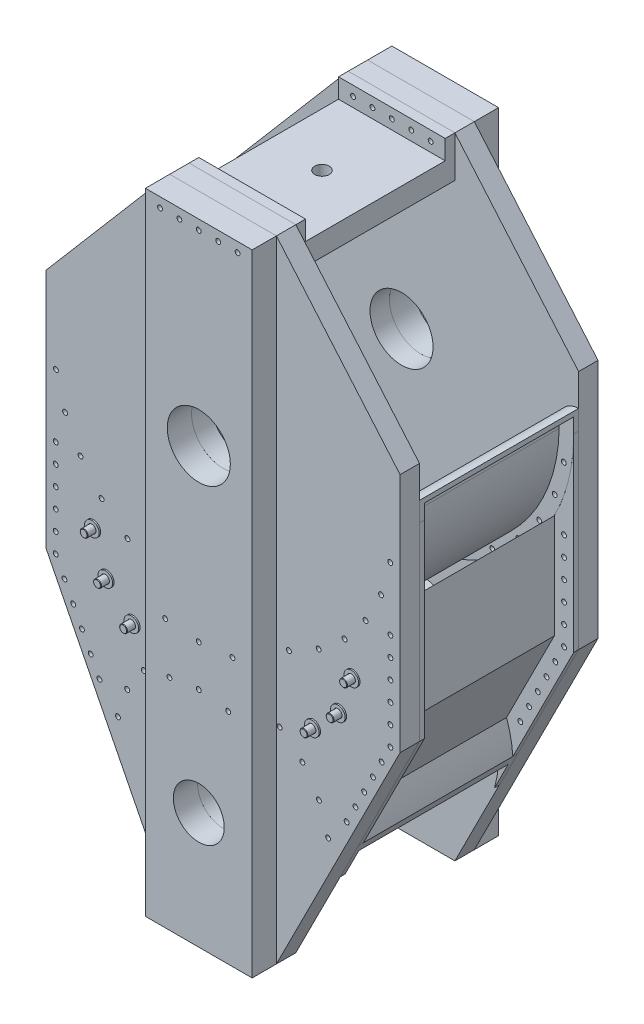
from build123d import *
from build123d.topology import SkipClean

# Parameters (mm, degrees)
PIASTRONEEXTR_DEPTH              = 40
LAMONE_DEPTH                     = 50
CARTEREXT1_START                 = 40
CARTEREXT1_DEPTH                 = 10
CARTEREXT2_START                 = 50
CARTEREXT2_DEPTH                 = 154
IRRIGIDCIRC1_START               = 40
IRRIGIDCIRC1_DEPTH               = 10
IRRIGIDCIRC2_START               = 50
IRRIGIDCIRC2_DEPTH               = 154
IRRIGIDESTERNO1_START            = 40
IRRIGIDESTERNO1_DEPTH            = 10
IRRIGIDESTERNO2_START            = 50
IRRIGIDESTERNO2_DEPTH            = 154
RINFORZOSUP1_START               = 40
SKETCH12_W                       = 110
SKETCH12_H                       = 85
RINFORZOSUP1_DEPTH               = 20
BOSS_EXTRUDE1_START              = 60
SKETCH12_4_W                     = 110
SKETCH12_4_H                     = 45
BOSS_EXTRUDE1_DEPTH              = 144
FOROCIRC3_START                  = -879.840067
SKETCH6_R                        = 5
FOROCIRC3_DEPTH                  = 1839.680133
LPATTERN11_COUNT                 = 6
LPATTERN11_PITCH                 = 40
LPATTERN21_COUNT                 = 6
LPATTERN21_PITCH                 = 40
FORIIRR_R                        = 9
FORICENTRALI_DEPTH               = 120
BUSSOLA_R                        = 18.5
BUSSOLA_R_2                      = 10.5
ROSETTA_DEPTH                    = 3
ROSETTA_2_DEPTH                  = 3
ROSETTA_3_DEPTH                  = 3
SKETCH16_R                       = 15
SKETCH16_R_2                     = 10.5
BUSSOLABODY_DEPTH                = 14
SKETCH17_R                       = 18.5
SKETCH17_R_2                     = 15.5
TUBO_DEPTH                       = 161
TUBO_2_DEPTH                     = 161
TUBO_3_DEPTH                     = 161
TIRANTE_DEPTH                    = 164
TIRANTE_DEPTH_BACK               = 60
SKETCH18_R                       = 8
TIRANTE_2_DEPTH                  = 164
TIRANTE_2_DEPTH_BACK             = 60
TIRANTE_3_DEPTH                  = 164
TIRANTE_3_DEPTH_BACK             = 60
CHAMFER1_SIZE                    = 1
CHAMFER2_SIZE                    = 1
CHAMFER3_SIZE                    = 1
SKETCH19_R                       = 15
SKETCH19_R_2                     = 8.5
ROSETTAM20_DEPTH                 = 3
ROSETTAM20_2_DEPTH               = 3
ROSETTAM20_3_DEPTH               = 3
SKETCH11_R                       = 5
FOROSUPERIORE_DEPTH              = 948.744578
LPATTERN23_COUNT                 = 3
LPATTERN23_PITCH                 = 40
LPATTERN23_COL_COUNT             = 3
LPATTERN23_COL_PITCH             = 40
FOROCIRC11_START                 = -948.744578
FORICIRC1_R                      = 5
FOROCIRC11_DEPTH                 = 1967.489157
CIRPATTERN24_COUNT               = 8
CIRPATTERN24_ANGLE               = 80
CIRPATTERN24_THE_OTHER_WAY_COUNT = 8
CIRPATTERN24_THE_OTHER_WAY_ANGLE = 80
FOROCIRC21_START                 = -948.744578
FOROCRIC2_R                      = 5
FOROCIRC21_DEPTH                 = 1977.489157
CIRPATTERN21_COUNT               = 6
CIRPATTERN21_ANGLE               = 80
CIRPATTERN21_THE_OTHER_WAY_COUNT = 6
CIRPATTERN21_THE_OTHER_WAY_ANGLE = 80
SKETCH20_R                       = 15
CUT_EXTRUDE1_DEPTH               = 1415.549517


with BuildPart() as part:
    # Piastrone → PiastroneExtr (new body)
    with BuildSketch(Plane.XY):
        with BuildLine():
            Line((-86.205427, 491.90505), (23.794573, 491.90505))
            Line((23.794573, 491.90505), (278.794573, 193.153386))
            Line((278.794573, 193.153386), (278.794573, -303.297279))
            Line((278.794573, -303.297279), (23.794573, -808.09495))
            Line((23.794573, -808.09495), (-86.205427, -808.09495))
            Line((-86.205427, -808.09495), (-86.205427, -620.59495))
            ThreePointArc((-86.205427, -620.59495), (-33.705427, -568.09495), (-86.205427, -515.59495))
            Line((-86.205427, -515.59495), (-86.205427, 21.90505))
            ThreePointArc((-86.205427, 21.90505), (-21.205427, 86.90505), (-86.205427, 151.90505))
            Line((-86.205427, 151.90505), (-86.205427, 491.90505))
        make_face()
    extrude(amount=PIASTRONEEXTR_DEPTH)


with BuildPart() as body_2:
    # Sketch14 → Lamone (new body)
    with BuildSketch(Plane(origin=(0, 0, 0), x_dir=(-1, 0, 0), z_dir=(0, 0, -1))):
        with BuildLine():
            Line((-23.794573, 491.90505), (86.205427, 491.90505))
            Line((86.205427, 491.90505), (86.205427, 151.90505))
            ThreePointArc((86.205427, 151.90505), (21.205427, 86.90505), (86.205427, 21.90505))
            Line((86.205427, 21.90505), (86.205427, -515.59495))
            ThreePointArc((86.205427, -515.59495), (33.705427, -568.09495), (86.205427, -620.59495))
            Line((86.205427, -620.59495), (86.205427, -808.09495))
            Line((86.205427, -808.09495), (-23.794573, -808.09495))
            Line((-23.794573, -808.09495), (-23.794573, 491.90505))
        make_face()
    extrude(amount=LAMONE_DEPTH)


with BuildPart() as body_3:
    # Carter → CarterExt1 (new body)
    with BuildSketch(Plane.XY.offset(CARTEREXT1_START)):
        with BuildLine():
            ThreePointArc((248.758008, 81.955617), (255.585083, 106.603062), (278.794573, 117.346667))
            Line((278.794573, 117.346667), (278.794573, 86.90505))
            ThreePointArc((278.794573, 86.90505), (171.888548, -171.188925), (-86.205427, -278.09495))
            Line((-86.205427, -278.09495), (-86.205427, -248.09495))
            ThreePointArc((-86.205427, -248.09495), (148.918944, -151.719195), (248.758008, 81.955617))
        make_face()
        with BuildLine():
            ThreePointArc((-86.205427, -248.09495), (148.918944, -151.719195), (248.758008, 81.955617))
            ThreePointArc((248.758008, 81.955617), (255.585083, 106.603062), (278.794573, 117.346667))
            Line((278.794573, 117.346667), (278.794573, 127.247816))
            ThreePointArc((278.794573, 127.247816), (248.567893, 113.623706), (238.756849, 81.953343))
            ThreePointArc((238.756849, 81.953343), (141.846864, -144.648729), (-86.205427, -238.09495))
            Line((-86.205427, -238.09495), (-86.205427, -248.09495))
        make_face()
    extrude(amount=CARTEREXT1_DEPTH)

    # Carter<4> → CarterExt2 (add)
    with BuildSketch(Plane.XY.offset(CARTEREXT2_START)):
        with BuildLine():
            ThreePointArc((-86.205427, -248.09495), (148.918944, -151.719195), (248.758008, 81.955617))
            ThreePointArc((248.758008, 81.955617), (255.585083, 106.603062), (278.794573, 117.346667))
            Line((278.794573, 117.346667), (278.794573, 127.247816))
            ThreePointArc((278.794573, 127.247816), (248.567893, 113.623706), (238.756849, 81.953343))
            ThreePointArc((238.756849, 81.953343), (141.846864, -144.648729), (-86.205427, -238.09495))
            Line((-86.205427, -238.09495), (-86.205427, -248.09495))
        make_face()
    extrude(amount=CARTEREXT2_DEPTH)


with BuildPart() as body_4:
    # IrrigidCirc → IrrigidCirc1 (new body)
    with BuildSketch(Plane.XY.offset(IRRIGIDCIRC1_START)):
        with BuildLine():
            ThreePointArc((-86.205427, -338.09495), (77.301662, -406.337627), (143.781261, -570.569457))
            Line((143.781261, -570.569457), (115.48454, -626.58561))
            ThreePointArc((115.48454, -626.58561), (81.697876, -441.966124), (-86.205427, -358.09495))
            Line((-86.205427, -358.09495), (-86.205427, -338.09495))
        make_face()
        with BuildLine():
            ThreePointArc((-86.205427, -328.09495), (77.651834, -392.735895), (153.243359, -551.8383))
            Line((153.243359, -551.8383), (143.781261, -570.569457))
            ThreePointArc((143.781261, -570.569457), (77.301662, -406.337627), (-86.205427, -338.09495))
            Line((-86.205427, -338.09495), (-86.205427, -328.09495))
        make_face()
    extrude(amount=IRRIGIDCIRC1_DEPTH)

    # IrrigidCirc<7> → IrrigidCirc2 (add)
    with BuildSketch(Plane.XY.offset(IRRIGIDCIRC2_START)):
        with BuildLine():
            ThreePointArc((-86.205427, -328.09495), (77.651834, -392.735895), (153.243359, -551.8383))
            Line((153.243359, -551.8383), (143.781261, -570.569457))
            ThreePointArc((143.781261, -570.569457), (77.301662, -406.337627), (-86.205427, -338.09495))
            Line((-86.205427, -338.09495), (-86.205427, -328.09495))
        make_face()
    extrude(amount=IRRIGIDCIRC2_DEPTH)


with BuildPart() as body_5:
    # Sketch9 → IrrigidEsterno1 (new body)
    with BuildSketch(Plane.XY.offset(IRRIGIDESTERNO1_START)):
        with BuildLine():
            Line((238.794573, -293.767656), (278.794573, -303.297279))
            Line((278.794573, -303.297279), (278.794573, 86.90505))
            ThreePointArc((278.794573, 86.90505), (268.6537, 1.465012), (238.794573, -79.227428))
            Line((238.794573, -79.227428), (238.794573, -293.767656))
        make_face()
        with BuildLine():
            Line((153.243359, -551.8383), (278.794573, -303.297279))
            Line((278.794573, -303.297279), (238.794573, -293.767656))
            Line((238.794573, -293.767656), (140.29903, -488.749307))
            ThreePointArc((140.29903, -488.749307), (148.897022, -519.857635), (153.243359, -551.8383))
        make_face()
        with BuildLine():
            Line((140.29903, -488.749307), (238.794573, -293.767656))
            Line((238.794573, -293.767656), (228.794573, -291.385251))
            Line((228.794573, -291.385251), (135.473141, -476.124236))
            ThreePointArc((135.473141, -476.124236), (137.974978, -482.402793), (140.29903, -488.749307))
        make_face()
        with BuildLine():
            Line((228.794573, -291.385251), (238.794573, -293.767656))
            Line((238.794573, -293.767656), (238.794573, -79.227428))
            ThreePointArc((238.794573, -79.227428), (233.924769, -88.427941), (228.794573, -97.485839))
            Line((228.794573, -97.485839), (228.794573, -291.385251))
        make_face()
    extrude(amount=IRRIGIDESTERNO1_DEPTH)

    # Sketch9<3> → IrrigidEsterno2 (add)
    with BuildSketch(Plane.XY.offset(IRRIGIDESTERNO2_START)):
        with BuildLine():
            Line((228.794573, -291.385251), (238.794573, -293.767656))
            Line((238.794573, -293.767656), (238.794573, -79.227428))
            ThreePointArc((238.794573, -79.227428), (233.924769, -88.427941), (228.794573, -97.485839))
            Line((228.794573, -97.485839), (228.794573, -291.385251))
        make_face()
        with BuildLine():
            Line((140.29903, -488.749307), (238.794573, -293.767656))
            Line((238.794573, -293.767656), (228.794573, -291.385251))
            Line((228.794573, -291.385251), (135.473141, -476.124236))
            ThreePointArc((135.473141, -476.124236), (137.974978, -482.402793), (140.29903, -488.749307))
        make_face()
    extrude(amount=IRRIGIDESTERNO2_DEPTH)


with BuildPart() as body_6:
    # Sketch12 → RinforzoSup1 (new body)
    with BuildSketch(Plane.XY.offset(RINFORZOSUP1_START)):
        with Locations((-31.205427, 449.40505)):
            Rectangle(SKETCH12_W, SKETCH12_H)
    extrude(amount=RINFORZOSUP1_DEPTH)

    # Sketch12<4> → Boss-Extrude1 (add)
    with BuildSketch(Plane.XY.offset(BOSS_EXTRUDE1_START)):
        with Locations((-31.205427, 429.40505)):
            Rectangle(SKETCH12_4_W, SKETCH12_4_H)
    extrude(amount=BOSS_EXTRUDE1_DEPTH)


with BuildPart() as forocirc3_tool:
    # Sketch6 → ForoCirc3 (new body)
    with BuildSketch(Plane.XY.offset(FOROCIRC3_START)):
        with Locations(Location((258.794573, -303.297279, 0), (0, 0, 180))):
            Circle(SKETCH6_R)
    forocirc3 = extrude(amount=FOROCIRC3_DEPTH)


with BuildPart() as part_1:
    add(part.part)

    # ForoCirc3: cut by forocirc3_tool
    add(forocirc3_tool.part, mode=Mode.SUBTRACT)


with BuildPart() as body_5_1:
    add(body_5.part)

    # ForoCirc3: cut by forocirc3_tool
    add(forocirc3_tool.part, mode=Mode.SUBTRACT)


with BuildPart() as lpattern11_tool:
    # LPattern11: ForoCirc3 ×6
    with Locations(*[(0, i * LPATTERN11_PITCH, 0) for i in range(1, LPATTERN11_COUNT)]):
        add(forocirc3)


with BuildPart() as part_2:
    add(part_1.part)

    # LPattern11: cut by lpattern11_tool
    add(lpattern11_tool.part, mode=Mode.SUBTRACT)


with BuildPart() as body_5_2:
    add(body_5_1.part)

    # LPattern11: cut by lpattern11_tool
    add(lpattern11_tool.part, mode=Mode.SUBTRACT)


with BuildPart() as lpattern21_tool:
    # LPattern21: ForoCirc3 ×6
    with Locations(*[Vector(-0.45088930046580106, -0.8925798780644008, 0) * (i * LPATTERN21_PITCH) for i in range(1, LPATTERN21_COUNT)]):
        add(forocirc3)


with BuildPart() as part_3:
    add(part_2.part)

    # LPattern21: cut by lpattern21_tool
    add(lpattern21_tool.part, mode=Mode.SUBTRACT)

    # ForiIrr → ForiCentrali (cut)
    with BuildSketch(Plane.XY):
        with Locations(Location((99.794573, -348.09495, 0), (0, 0, 180))):
            Circle(FORIIRR_R)
        with Locations(Location((153.534688, -294.354835, 0), (0, 0, 180))):
            Circle(FORIIRR_R)
        with Locations(Location((181.196426, -218.354835, 0), (0, 0, 180))):
            Circle(FORIIRR_R)
    extrude(amount=FORICENTRALI_DEPTH, mode=Mode.SUBTRACT)


with BuildPart() as body_5_3:
    add(body_5_2.part)

    # LPattern21: cut by lpattern21_tool
    add(lpattern21_tool.part, mode=Mode.SUBTRACT)


with BuildPart() as body_7:
    # Bussola → Rosetta (new body)
    with BuildSketch(Plane.XY.offset(40)):
        with Locations((181.196426, -218.354835)):
            Circle(BUSSOLA_R)
        with Locations((181.196426, -218.354835)):
            Circle(BUSSOLA_R_2, mode=Mode.SUBTRACT)
    extrude(amount=ROSETTA_DEPTH)



with BuildPart() as body_8:
    # Bussola → Rosetta 2 (new body)
    with BuildSketch(Plane.XY.offset(40)):
        with Locations((153.534688, -294.354835)):
            Circle(BUSSOLA_R)
        with Locations((153.534688, -294.354835)):
            Circle(BUSSOLA_R_2, mode=Mode.SUBTRACT)
    extrude(amount=ROSETTA_2_DEPTH)


with BuildPart() as body_9:
    # Bussola → Rosetta 3 (new body)
    with BuildSketch(Plane.XY.offset(40)):
        with Locations((99.794573, -348.09495)):
            Circle(BUSSOLA_R)
        with Locations((99.794573, -348.09495)):
            Circle(BUSSOLA_R_2, mode=Mode.SUBTRACT)
    extrude(amount=ROSETTA_3_DEPTH)


with BuildPart() as body_7_1:
    add(body_7.part)

    add(body_8.part)  # BussolaBody merges body 8

    add(body_9.part)  # BussolaBody merges body 9
    # Sketch16 → BussolaBody (add)
    # profile 1 of 3: a face of its own
    with BuildSketch(Plane.XY.offset(43)):
        with Locations((181.196426, -218.354835)):
            Circle(SKETCH16_R)
        with Locations((181.196426, -218.354835)):
            Circle(SKETCH16_R_2, mode=Mode.SUBTRACT)
    # profile 2 of 3: a face of its own
    with BuildSketch(Plane.XY.offset(43)):
        with Locations((99.794573, -348.09495)):
            Circle(SKETCH16_R)
        with Locations((99.794573, -348.09495)):
            Circle(SKETCH16_R_2, mode=Mode.SUBTRACT)
    # profile 3 of 3: a face of its own
    with BuildSketch(Plane.XY.offset(43)):
        with Locations((153.534688, -294.354835)):
            Circle(SKETCH16_R)
        with Locations((153.534688, -294.354835)):
            Circle(SKETCH16_R_2, mode=Mode.SUBTRACT)
    extrude(amount=BUSSOLABODY_DEPTH)


with BuildPart() as body_8_2:
    # Sketch17 → Tubo (new body)
    with BuildSketch(Plane.XY.offset(43)):
        with Locations(Location((181.196426, -218.354835, 0), (0, 0, 180))):
            Circle(SKETCH17_R)
        with Locations(Location((181.196426, -218.354835, 0), (0, 0, 180))):
            Circle(SKETCH17_R_2, mode=Mode.SUBTRACT)
    extrude(amount=TUBO_DEPTH)


with BuildPart() as body_9_2:
    # Sketch17 → Tubo 2 (new body)
    with BuildSketch(Plane.XY.offset(43)):
        with Locations(Location((153.534688, -294.354835, 0), (0, 0, 180))):
            Circle(SKETCH17_R)
        with Locations(Location((153.534688, -294.354835, 0), (0, 0, 180))):
            Circle(SKETCH17_R_2, mode=Mode.SUBTRACT)
    extrude(amount=TUBO_2_DEPTH)


with BuildPart() as body_10:
    # Sketch17 → Tubo 3 (new body)
    with BuildSketch(Plane.XY.offset(43)):
        with Locations(Location((99.794573, -348.09495, 0), (0, 0, 180))):
            Circle(SKETCH17_R)
        with Locations(Location((99.794573, -348.09495, 0), (0, 0, 180))):
            Circle(SKETCH17_R_2, mode=Mode.SUBTRACT)
    extrude(amount=TUBO_3_DEPTH)


with BuildPart() as body_11:
    # Sketch18 → Tirante (new, two sides: drawn at the far end of the back side and taken through both)
    with BuildSketch(Plane.XY.offset(40).offset(-TIRANTE_DEPTH_BACK)):
        with Locations((181.196426, -218.354835)):
            Circle(SKETCH18_R)
    extrude(amount=TIRANTE_DEPTH + TIRANTE_DEPTH_BACK)

    # Chamfer1
    chamfer1_edges = [body_11.edges().sort_by_distance(p)[0] for p in [
        (173.196426, -218.354835, -20),
    ]]
    chamfer(chamfer1_edges, length=CHAMFER1_SIZE)


with BuildPart() as body_12:
    # Sketch18 → Tirante 2 (new, two sides: drawn at the far end of the back side and taken through both)
    with BuildSketch(Plane.XY.offset(40).offset(-TIRANTE_2_DEPTH_BACK)):
        with Locations((153.534688, -294.354835)):
            Circle(SKETCH18_R)
    extrude(amount=TIRANTE_2_DEPTH + TIRANTE_2_DEPTH_BACK)

    # Chamfer2
    chamfer2_edges = [body_12.edges().sort_by_distance(p)[0] for p in [
        (145.534688, -294.354835, -20),
    ]]
    chamfer(chamfer2_edges, length=CHAMFER2_SIZE)


with BuildPart() as body_13:
    # Sketch18 → Tirante 3 (new, two sides: drawn at the far end of the back side and taken through both)
    with BuildSketch(Plane.XY.offset(40).offset(-TIRANTE_3_DEPTH_BACK)):
        with Locations((99.794573, -348.09495)):
            Circle(SKETCH18_R)
    extrude(amount=TIRANTE_3_DEPTH + TIRANTE_3_DEPTH_BACK)

    # Chamfer3
    chamfer3_edges = [body_13.edges().sort_by_distance(p)[0] for p in [
        (91.794573, -348.09495, -20),
    ]]
    chamfer(chamfer3_edges, length=CHAMFER3_SIZE)


with BuildPart() as body_14:
    # Sketch19 → RosettaM20 (new body)
    with BuildSketch(Plane(origin=(0, 0, 0), x_dir=(-1, 0, 0), z_dir=(0, 0, -1))):
        with Locations((-181.196426, -218.354835)):
            Circle(SKETCH19_R)
        with Locations((-181.196426, -218.354835)):
            Circle(SKETCH19_R_2, mode=Mode.SUBTRACT)
    extrude(amount=ROSETTAM20_DEPTH)


with BuildPart() as body_15:
    # Sketch19 → RosettaM20 2 (new body)
    with BuildSketch(Plane(origin=(0, 0, 0), x_dir=(-1, 0, 0), z_dir=(0, 0, -1))):
        with Locations((-153.534688, -294.354835)):
            Circle(SKETCH19_R)
        with Locations((-153.534688, -294.354835)):
            Circle(SKETCH19_R_2, mode=Mode.SUBTRACT)
    extrude(amount=ROSETTAM20_2_DEPTH)


with BuildPart() as body_16:
    # Sketch19 → RosettaM20 3 (new body)
    with BuildSketch(Plane(origin=(0, 0, 0), x_dir=(-1, 0, 0), z_dir=(0, 0, -1))):
        with Locations((-99.794573, -348.09495)):
            Circle(SKETCH19_R)
        with Locations((-99.794573, -348.09495)):
            Circle(SKETCH19_R_2, mode=Mode.SUBTRACT)
    extrude(amount=ROSETTAM20_3_DEPTH)


with BuildPart() as body_17:
    # Mirror1: mirrored copy
    add(part_3.part.mirror(Plane(origin=(-86.205427, -515.59495, 40), x_dir=(0, 0, 1), z_dir=(1, 0, 0))))


with BuildPart() as body_18:
    # Mirror1 2: mirrored copy
    add(body_2.part.mirror(Plane(origin=(-86.205427, -515.59495, 40), x_dir=(0, 0, 1), z_dir=(1, 0, 0))))

    # LamoneBody: union body 2
    add(body_2.part)


with BuildPart() as body_19:
    # Mirror1 3: mirrored copy
    add(body_3.part.mirror(Plane(origin=(-86.205427, -515.59495, 40), x_dir=(0, 0, 1), z_dir=(1, 0, 0))))


with BuildPart() as body_20:
    # Mirror1 4: mirrored copy
    add(body_4.part.mirror(Plane(origin=(-86.205427, -515.59495, 40), x_dir=(0, 0, 1), z_dir=(1, 0, 0))))


with BuildPart() as body_21:
    # Mirror1 5: mirrored copy
    add(body_5_3.part.mirror(Plane(origin=(-86.205427, -515.59495, 40), x_dir=(0, 0, 1), z_dir=(1, 0, 0))))


with BuildPart() as body_22:
    # Mirror1 6: mirrored copy
    add(body_6.part.mirror(Plane(origin=(-86.205427, -515.59495, 40), x_dir=(0, 0, 1), z_dir=(1, 0, 0))))


with BuildPart() as body_23:
    # Mirror1 7: mirrored copy
    add(body_7_1.part.mirror(Plane(origin=(-86.205427, -515.59495, 40), x_dir=(0, 0, 1), z_dir=(1, 0, 0))))


with BuildPart() as body_24:
    # Mirror1 8: mirrored copy
    add(body_8_2.part.mirror(Plane(origin=(-86.205427, -515.59495, 40), x_dir=(0, 0, 1), z_dir=(1, 0, 0))))


with BuildPart() as body_25:
    # Mirror1 9: mirrored copy
    add(body_9_2.part.mirror(Plane(origin=(-86.205427, -515.59495, 40), x_dir=(0, 0, 1), z_dir=(1, 0, 0))))


with BuildPart() as body_26:
    # Mirror1 10: mirrored copy
    add(body_10.part.mirror(Plane(origin=(-86.205427, -515.59495, 40), x_dir=(0, 0, 1), z_dir=(1, 0, 0))))


with BuildPart() as body_27:
    # Mirror1 11: mirrored copy
    add(body_11.part.mirror(Plane(origin=(-86.205427, -515.59495, 40), x_dir=(0, 0, 1), z_dir=(1, 0, 0))))


with BuildPart() as body_28:
    # Mirror1 12: mirrored copy
    add(body_12.part.mirror(Plane(origin=(-86.205427, -515.59495, 40), x_dir=(0, 0, 1), z_dir=(1, 0, 0))))


with BuildPart() as body_29:
    # Mirror1 13: mirrored copy
    add(body_13.part.mirror(Plane(origin=(-86.205427, -515.59495, 40), x_dir=(0, 0, 1), z_dir=(1, 0, 0))))


with BuildPart() as body_30:
    # Mirror1 14: mirrored copy
    add(body_14.part.mirror(Plane(origin=(-86.205427, -515.59495, 40), x_dir=(0, 0, 1), z_dir=(1, 0, 0))))


with BuildPart() as body_31:
    # Mirror1 15: mirrored copy
    add(body_15.part.mirror(Plane(origin=(-86.205427, -515.59495, 40), x_dir=(0, 0, 1), z_dir=(1, 0, 0))))


with BuildPart() as body_32:
    # Mirror1 16: mirrored copy
    add(body_16.part.mirror(Plane(origin=(-86.205427, -515.59495, 40), x_dir=(0, 0, 1), z_dir=(1, 0, 0))))


with BuildPart() as part_4:
    add(part_3.part)

    # PiastroneBody: union body 17
    add(body_17.part)


with BuildPart() as body_4_1:
    add(body_4.part)

    # IrrCircInfBody: union body 20
    add(body_20.part)


with BuildPart() as body_3_1:
    add(body_3.part)

    # IrrCircSupBody: union body 19
    add(body_19.part)


with BuildPart() as body_6_1:
    add(body_6.part)

    # IrrSupBody: union body 22
    add(body_22.part)


with BuildPart() as forosuperiore_tool:
    # Sketch11 → ForoSuperiore (new, symmetric)
    with SkipClean():  # the faces are left unmerged after this step: merging them gives an invalid solid
        with BuildSketch(Plane.XY):
            with Locations(Location((-86.205427, 471.90505, 0), (0, 0, 180))):
                Circle(SKETCH11_R)
        forosuperiore = extrude(amount=FOROSUPERIORE_DEPTH, both=True)


with BuildPart() as part_5:
    with SkipClean():  # the faces are left unmerged after this step: merging them gives an invalid solid
        add(part_4.part)

        # ForoSuperiore: cut by forosuperiore_tool
        add(forosuperiore_tool.part, mode=Mode.SUBTRACT)


with BuildPart() as body_6_2:
    with SkipClean():  # the faces are left unmerged after this step: merging them gives an invalid solid
        add(body_6_1.part)

        # ForoSuperiore: cut by forosuperiore_tool
        add(forosuperiore_tool.part, mode=Mode.SUBTRACT)


with BuildPart() as body_18_1:
    with SkipClean():  # the faces are left unmerged after this step: merging them gives an invalid solid
        add(body_18.part)

        # ForoSuperiore: cut by forosuperiore_tool
        add(forosuperiore_tool.part, mode=Mode.SUBTRACT)


with BuildPart() as lpattern23_tool:
    # LPattern23: ForoSuperiore ×3
    with SkipClean():  # the faces are left unmerged after this step: merging them gives an invalid solid
        with Locations(*[(i * LPATTERN23_PITCH, 0, 0) for i in range(1, LPATTERN23_COUNT)]):
            add(forosuperiore)


with BuildPart() as part_6:
    with SkipClean():  # the faces are left unmerged after this step: merging them gives an invalid solid
        add(part_5.part)

        # LPattern23: cut by lpattern23_tool
        add(lpattern23_tool.part, mode=Mode.SUBTRACT)


with BuildPart() as body_6_3:
    with SkipClean():  # the faces are left unmerged after this step: merging them gives an invalid solid
        add(body_6_2.part)

        # LPattern23: cut by lpattern23_tool
        add(lpattern23_tool.part, mode=Mode.SUBTRACT)


with BuildPart() as body_18_2:
    with SkipClean():  # the faces are left unmerged after this step: merging them gives an invalid solid
        add(body_18_1.part)

        # LPattern23: cut by lpattern23_tool
        add(lpattern23_tool.part, mode=Mode.SUBTRACT)


with BuildPart() as lpattern23_col_tool:
    # LPattern23 col: ForoSuperiore ×3
    with SkipClean():  # the faces are left unmerged after this step: merging them gives an invalid solid
        with Locations(*[(-i * LPATTERN23_COL_PITCH, 0, 0) for i in range(1, LPATTERN23_COL_COUNT)]):
            add(forosuperiore)


with BuildPart() as part_7:
    with SkipClean():  # the faces are left unmerged after this step: merging them gives an invalid solid
        add(part_6.part)

        # LPattern23 col: cut by lpattern23_col_tool
        add(lpattern23_col_tool.part, mode=Mode.SUBTRACT)


with BuildPart() as body_6_4:
    with SkipClean():  # the faces are left unmerged after this step: merging them gives an invalid solid
        add(body_6_3.part)

        # LPattern23 col: cut by lpattern23_col_tool
        add(lpattern23_col_tool.part, mode=Mode.SUBTRACT)


with BuildPart() as body_18_3:
    with SkipClean():  # the faces are left unmerged after this step: merging them gives an invalid solid
        add(body_18_2.part)

        # LPattern23 col: cut by lpattern23_col_tool
        add(lpattern23_col_tool.part, mode=Mode.SUBTRACT)


with BuildPart() as forocirc11_tool:
    # ForiCirc1 → ForoCirc11 (new body)
    with SkipClean():  # the faces are left unmerged after this step: merging them gives an invalid solid
        with BuildSketch(Plane.XY.offset(FOROCIRC11_START)):
            with Locations((-86.205427, -262.971043)):
                Circle(FORICIRC1_R)
        forocirc11 = extrude(amount=FOROCIRC11_DEPTH)


with BuildPart() as part_8:
    with SkipClean():  # the faces are left unmerged after this step: merging them gives an invalid solid
        add(part_7.part)

        # ForoCirc11: cut by forocirc11_tool
        add(forocirc11_tool.part, mode=Mode.SUBTRACT)


with BuildPart() as body_3_2:
    with SkipClean():  # the faces are left unmerged after this step: merging them gives an invalid solid
        add(body_3_1.part)

        # ForoCirc11: cut by forocirc11_tool
        add(forocirc11_tool.part, mode=Mode.SUBTRACT)


with BuildPart() as body_18_4:
    with SkipClean():  # the faces are left unmerged after this step: merging them gives an invalid solid
        add(body_18_3.part)

        # ForoCirc11: cut by forocirc11_tool
        add(forocirc11_tool.part, mode=Mode.SUBTRACT)


with BuildPart() as cirpattern24_tool:
    # CirPattern24: ForoCirc11 ×8 about axis
    with SkipClean():  # the faces are left unmerged after this step: merging them gives an invalid solid
        cirpattern24_axis = Axis((-86.205427, 86.90505, 0), (0, 0, -1))
        for i in range(1, CIRPATTERN24_COUNT):
            add(forocirc11.rotate(cirpattern24_axis, i * CIRPATTERN24_ANGLE / (CIRPATTERN24_COUNT - 1)))


with BuildPart() as part_9:
    with SkipClean():  # the faces are left unmerged after this step: merging them gives an invalid solid
        add(part_8.part)

        # CirPattern24: cut by cirpattern24_tool
        add(cirpattern24_tool.part, mode=Mode.SUBTRACT)


with BuildPart() as body_3_3:
    with SkipClean():  # the faces are left unmerged after this step: merging them gives an invalid solid
        add(body_3_2.part)

        # CirPattern24: cut by cirpattern24_tool
        add(cirpattern24_tool.part, mode=Mode.SUBTRACT)


with BuildPart() as body_18_5:
    with SkipClean():  # the faces are left unmerged after this step: merging them gives an invalid solid
        add(body_18_4.part)

        # CirPattern24: cut by cirpattern24_tool
        add(cirpattern24_tool.part, mode=Mode.SUBTRACT)


with BuildPart() as cirpattern24_the_other_way_tool:
    # CirPattern24 the other way: ForoCirc11 ×8 about axis
    with SkipClean():  # the faces are left unmerged after this step: merging them gives an invalid solid
        cirpattern24_the_other_way_axis = Axis((-86.205427, 86.90505, 0), (0, 0, 1))
        for i in range(1, CIRPATTERN24_THE_OTHER_WAY_COUNT):
            add(forocirc11.rotate(cirpattern24_the_other_way_axis, i * CIRPATTERN24_THE_OTHER_WAY_ANGLE / (CIRPATTERN24_THE_OTHER_WAY_COUNT - 1)))


with BuildPart() as part_10:
    with SkipClean():  # the faces are left unmerged after this step: merging them gives an invalid solid
        add(part_9.part)

        # CirPattern24 the other way: cut by cirpattern24_the_other_way_tool
        add(cirpattern24_the_other_way_tool.part, mode=Mode.SUBTRACT)


with BuildPart() as body_3_4:
    with SkipClean():  # the faces are left unmerged after this step: merging them gives an invalid solid
        add(body_3_3.part)

        # CirPattern24 the other way: cut by cirpattern24_the_other_way_tool
        add(cirpattern24_the_other_way_tool.part, mode=Mode.SUBTRACT)


with BuildPart() as body_18_6:
    with SkipClean():  # the faces are left unmerged after this step: merging them gives an invalid solid
        add(body_18_5.part)

        # CirPattern24 the other way: cut by cirpattern24_the_other_way_tool
        add(cirpattern24_the_other_way_tool.part, mode=Mode.SUBTRACT)


with BuildPart() as forocirc21_tool:
    # ForoCric2 → ForoCirc21 (new body)
    with SkipClean():  # the faces are left unmerged after this step: merging them gives an invalid solid
        with BuildSketch(Plane.XY.offset(FOROCIRC21_START)):
            with Locations((-86.205427, -348.09495)):
                Circle(FOROCRIC2_R)
        forocirc21 = extrude(amount=FOROCIRC21_DEPTH)


with BuildPart() as part_11:
    with SkipClean():  # the faces are left unmerged after this step: merging them gives an invalid solid
        add(part_10.part)

        # ForoCirc21: cut by forocirc21_tool
        add(forocirc21_tool.part, mode=Mode.SUBTRACT)


with BuildPart() as body_4_2:
    with SkipClean():  # the faces are left unmerged after this step: merging them gives an invalid solid
        add(body_4_1.part)

        # ForoCirc21: cut by forocirc21_tool
        add(forocirc21_tool.part, mode=Mode.SUBTRACT)


with BuildPart() as body_18_7:
    with SkipClean():  # the faces are left unmerged after this step: merging them gives an invalid solid
        add(body_18_6.part)

        # ForoCirc21: cut by forocirc21_tool
        add(forocirc21_tool.part, mode=Mode.SUBTRACT)


with BuildPart() as cirpattern21_tool:
    # CirPattern21: ForoCirc21 ×6 about axis
    with SkipClean():  # the faces are left unmerged after this step: merging them gives an invalid solid
        cirpattern21_axis = Axis((-86.205427, -568.09495, 0), (0, 0, -1))
        for i in range(1, CIRPATTERN21_COUNT):
            add(forocirc21.rotate(cirpattern21_axis, i * CIRPATTERN21_ANGLE / (CIRPATTERN21_COUNT - 1)))


with BuildPart() as part_12:
    with SkipClean():  # the faces are left unmerged after this step: merging them gives an invalid solid
        add(part_11.part)

        # CirPattern21: cut by cirpattern21_tool
        add(cirpattern21_tool.part, mode=Mode.SUBTRACT)


with BuildPart() as body_4_3:
    with SkipClean():  # the faces are left unmerged after this step: merging them gives an invalid solid
        add(body_4_2.part)

        # CirPattern21: cut by cirpattern21_tool
        add(cirpattern21_tool.part, mode=Mode.SUBTRACT)


with BuildPart() as body_18_8:
    with SkipClean():  # the faces are left unmerged after this step: merging them gives an invalid solid
        add(body_18_7.part)

        # CirPattern21: cut by cirpattern21_tool
        add(cirpattern21_tool.part, mode=Mode.SUBTRACT)


with BuildPart() as cirpattern21_the_other_way_tool:
    # CirPattern21 the other way: ForoCirc21 ×6 about axis
    with SkipClean():  # the faces are left unmerged after this step: merging them gives an invalid solid
        cirpattern21_the_other_way_axis = Axis((-86.205427, -568.09495, 0), (0, 0, 1))
        for i in range(1, CIRPATTERN21_THE_OTHER_WAY_COUNT):
            add(forocirc21.rotate(cirpattern21_the_other_way_axis, i * CIRPATTERN21_THE_OTHER_WAY_ANGLE / (CIRPATTERN21_THE_OTHER_WAY_COUNT - 1)))


with BuildPart() as part_13:
    with SkipClean():  # the faces are left unmerged after this step: merging them gives an invalid solid
        add(part_12.part)

        # CirPattern21 the other way: cut by cirpattern21_the_other_way_tool
        add(cirpattern21_the_other_way_tool.part, mode=Mode.SUBTRACT)


with BuildPart() as body_4_4:
    with SkipClean():  # the faces are left unmerged after this step: merging them gives an invalid solid
        add(body_4_3.part)

        # CirPattern21 the other way: cut by cirpattern21_the_other_way_tool
        add(cirpattern21_the_other_way_tool.part, mode=Mode.SUBTRACT)


with BuildPart() as body_18_9:
    with SkipClean():  # the faces are left unmerged after this step: merging them gives an invalid solid
        add(body_18_8.part)

        # CirPattern21 the other way: cut by cirpattern21_the_other_way_tool
        add(cirpattern21_the_other_way_tool.part, mode=Mode.SUBTRACT)


with BuildPart() as body_28_2:
    # Mirror2: mirrored copy
    add(part_13.part.mirror(Plane(origin=(278.794573, 86.90505, 204), x_dir=(1, 0, 0), z_dir=(0, 0, -1))))


with BuildPart() as body_29_2:
    # Mirror2 2: mirrored copy
    add(body_3_4.part.mirror(Plane(origin=(278.794573, 86.90505, 204), x_dir=(1, 0, 0), z_dir=(0, 0, -1))))


with BuildPart() as body_30_2:
    # Mirror2 3: mirrored copy
    add(body_4_4.part.mirror(Plane(origin=(278.794573, 86.90505, 204), x_dir=(1, 0, 0), z_dir=(0, 0, -1))))

    # Combine8: union body 4
    add(body_4_4.part)


with BuildPart() as body_31_2:
    # Mirror2 4: mirrored copy
    add(body_5_3.part.mirror(Plane(origin=(278.794573, 86.90505, 204), x_dir=(1, 0, 0), z_dir=(0, 0, -1))))

    # Combine10: union body 5
    add(body_5_3.part)


with BuildPart() as body_32_2:
    # Mirror2 5: mirrored copy
    add(body_6_4.part.mirror(Plane(origin=(278.794573, 86.90505, 204), x_dir=(1, 0, 0), z_dir=(0, 0, -1))))


with BuildPart() as body_33:
    # Mirror2 6: mirrored copy
    add(body_7_1.part.mirror(Plane(origin=(278.794573, 86.90505, 204), x_dir=(1, 0, 0), z_dir=(0, 0, -1))))


with BuildPart() as body_34:
    # Mirror2 7: mirrored copy
    add(body_8_2.part.mirror(Plane(origin=(278.794573, 86.90505, 204), x_dir=(1, 0, 0), z_dir=(0, 0, -1))))


with BuildPart() as body_35:
    # Mirror2 8: mirrored copy
    add(body_9_2.part.mirror(Plane(origin=(278.794573, 86.90505, 204), x_dir=(1, 0, 0), z_dir=(0, 0, -1))))


with BuildPart() as body_36:
    # Mirror2 9: mirrored copy
    add(body_10.part.mirror(Plane(origin=(278.794573, 86.90505, 204), x_dir=(1, 0, 0), z_dir=(0, 0, -1))))


with BuildPart() as body_37:
    # Mirror2 10: mirrored copy
    add(body_11.part.mirror(Plane(origin=(278.794573, 86.90505, 204), x_dir=(1, 0, 0), z_dir=(0, 0, -1))))


with BuildPart() as body_38:
    # Mirror2 11: mirrored copy
    add(body_12.part.mirror(Plane(origin=(278.794573, 86.90505, 204), x_dir=(1, 0, 0), z_dir=(0, 0, -1))))


with BuildPart() as body_39:
    # Mirror2 12: mirrored copy
    add(body_13.part.mirror(Plane(origin=(278.794573, 86.90505, 204), x_dir=(1, 0, 0), z_dir=(0, 0, -1))))


with BuildPart() as body_40:
    # Mirror2 13: mirrored copy
    add(body_14.part.mirror(Plane(origin=(278.794573, 86.90505, 204), x_dir=(1, 0, 0), z_dir=(0, 0, -1))))


with BuildPart() as body_41:
    # Mirror2 14: mirrored copy
    add(body_15.part.mirror(Plane(origin=(278.794573, 86.90505, 204), x_dir=(1, 0, 0), z_dir=(0, 0, -1))))


with BuildPart() as body_42:
    # Mirror2 15: mirrored copy
    add(body_16.part.mirror(Plane(origin=(278.794573, 86.90505, 204), x_dir=(1, 0, 0), z_dir=(0, 0, -1))))


with BuildPart() as body_43:
    # Mirror2 16: mirrored copy
    add(body_18_9.part.mirror(Plane(origin=(278.794573, 86.90505, 204), x_dir=(1, 0, 0), z_dir=(0, 0, -1))))


with BuildPart() as body_44:
    # Mirror2 17: mirrored copy
    add(body_21.part.mirror(Plane(origin=(278.794573, 86.90505, 204), x_dir=(1, 0, 0), z_dir=(0, 0, -1))))


with BuildPart() as body_45:
    # Mirror2 18: mirrored copy
    add(body_23.part.mirror(Plane(origin=(278.794573, 86.90505, 204), x_dir=(1, 0, 0), z_dir=(0, 0, -1))))


with BuildPart() as body_46:
    # Mirror2 19: mirrored copy
    add(body_24.part.mirror(Plane(origin=(278.794573, 86.90505, 204), x_dir=(1, 0, 0), z_dir=(0, 0, -1))))


with BuildPart() as body_47:
    # Mirror2 20: mirrored copy
    add(body_25.part.mirror(Plane(origin=(278.794573, 86.90505, 204), x_dir=(1, 0, 0), z_dir=(0, 0, -1))))


with BuildPart() as body_48:
    # Mirror2 21: mirrored copy
    add(body_26.part.mirror(Plane(origin=(278.794573, 86.90505, 204), x_dir=(1, 0, 0), z_dir=(0, 0, -1))))


with BuildPart() as body_49:
    # Mirror2 22: mirrored copy
    add(body_27.part.mirror(Plane(origin=(278.794573, 86.90505, 204), x_dir=(1, 0, 0), z_dir=(0, 0, -1))))


with BuildPart() as body_50:
    # Mirror2 23: mirrored copy
    add(body_28.part.mirror(Plane(origin=(278.794573, 86.90505, 204), x_dir=(1, 0, 0), z_dir=(0, 0, -1))))


with BuildPart() as body_51:
    # Mirror2 24: mirrored copy
    add(body_29.part.mirror(Plane(origin=(278.794573, 86.90505, 204), x_dir=(1, 0, 0), z_dir=(0, 0, -1))))


with BuildPart() as body_52:
    # Mirror2 25: mirrored copy
    add(body_30.part.mirror(Plane(origin=(278.794573, 86.90505, 204), x_dir=(1, 0, 0), z_dir=(0, 0, -1))))


with BuildPart() as body_53:
    # Mirror2 26: mirrored copy
    add(body_31.part.mirror(Plane(origin=(278.794573, 86.90505, 204), x_dir=(1, 0, 0), z_dir=(0, 0, -1))))


with BuildPart() as body_54:
    # Mirror2 27: mirrored copy
    add(body_32.part.mirror(Plane(origin=(278.794573, 86.90505, 204), x_dir=(1, 0, 0), z_dir=(0, 0, -1))))


with BuildPart() as cut_extrude1_tool:
    # Sketch20 → Cut-Extrude1 (new, through all)
    with BuildSketch(Plane(origin=(0, 451.90505, 0), x_dir=(1, 0, 0), z_dir=(0, 1, 0))):
        with Locations((-86.205427, -204)):
            Circle(SKETCH20_R)
    extrude(amount=-CUT_EXTRUDE1_DEPTH)


with BuildPart() as body_6_5:
    add(body_6_4.part)

    # Cut-Extrude1: cut by cut_extrude1_tool
    add(cut_extrude1_tool.part, mode=Mode.SUBTRACT)


with BuildPart() as body_32_2_1:
    add(body_32_2.part)

    # Cut-Extrude1: cut by cut_extrude1_tool
    add(cut_extrude1_tool.part, mode=Mode.SUBTRACT)


with BuildPart() as body_6_6:
    add(body_6_5.part)

    # Combine6: union body 32 2
    add(body_32_2_1.part)


with BuildPart() as body_21_1:
    add(body_21.part)

    # Combine7: union body 44
    add(body_44.part)


with BuildPart() as body_3_5:
    add(body_3_4.part)

    # Combine9: union body 29 2
    add(body_29_2.part)


solid = Compound([body_7_1.part, body_8_2.part, body_9_2.part, body_10.part, body_11.part, body_12.part, body_13.part, body_14.part, body_15.part, body_16.part, body_23.part, body_24.part, body_25.part, body_26.part, body_27.part, body_28.part, body_29.part, body_30.part, body_31.part, body_32.part, part_13.part, body_18_9.part, body_28_2.part, body_30_2.part, body_31_2.part, body_33.part, body_34.part, body_35.part, body_36.part, body_37.part, body_38.part, body_39.part, body_40.part, body_41.part, body_42.part, body_43.part, body_45.part, body_46.part, body_47.part, body_48.part, body_49.part, body_50.part, body_51.part, body_52.part, body_53.part, body_54.part, body_6_6.part, body_21_1.part, body_3_5.part])
